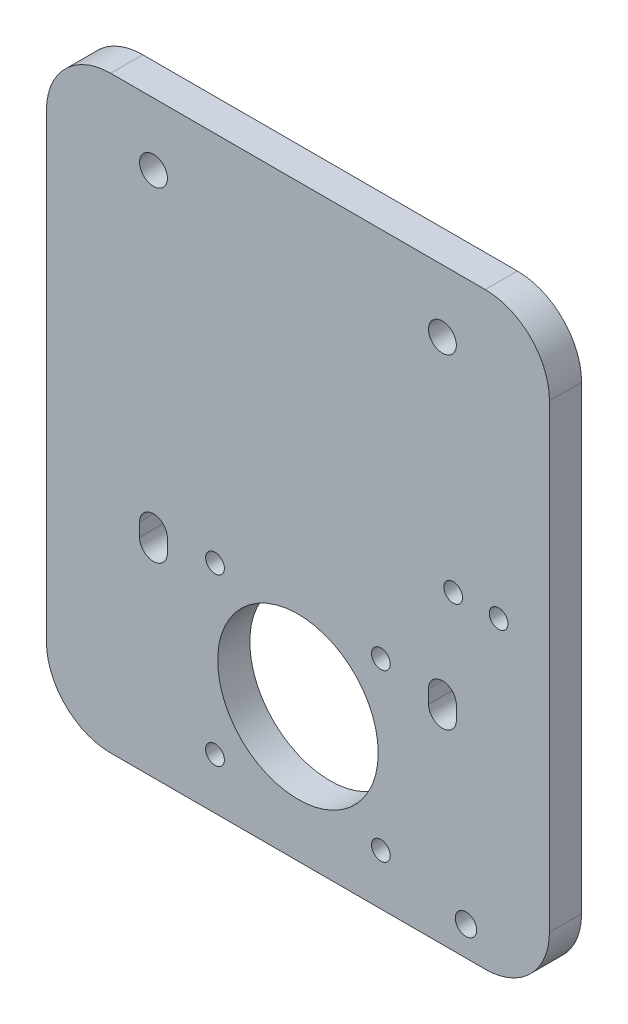
from build123d import *

# Parameters (mm, degrees)
MODEL_R               = 1.75
MODEL_R_2             = 15
MODEL_R_3             = 2.6
BASE_DEPTH            = 6
SKETCH1_R             = 1.75
CABLECHAINMOUNT_DEPTH = 10
SKETCH2_R             = 2
CABLETIEMOUNT_DEPTH   = 120.770614092


with BuildPart() as part:
    # Model → Base (new body)
    with BuildSketch(Plane.XY):
        with BuildLine():
            Line((47, 12), (47, 98))
            ThreePointArc((47, 98), (43.485281374, 106.485281374), (35, 110))
            Line((35, 110), (-35, 110))
            ThreePointArc((-35, 110), (-43.485281374, 106.485281374), (-47, 98))
            Line((-47, 98), (-47, 12))
            ThreePointArc((-47, 12), (-43.485281374, 3.514718626), (-35, 0))
            Line((-35, 0), (35, 0))
            ThreePointArc((35, 0), (43.485281374, 3.514718626), (47, 12))
        make_face()
        with Locations((-15.5, 9.5)):
            Circle(MODEL_R, mode=Mode.SUBTRACT)
        with BuildLine():
            Line((-29.6, 37.6), (-29.6, 40.1))
            ThreePointArc((-29.6, 40.1), (-27, 42.7), (-24.4, 40.1))
            Line((-24.4, 40.1), (-24.4, 37.6))
            ThreePointArc((-24.4, 37.6), (-27, 35), (-29.6, 37.6))
        make_face(mode=Mode.SUBTRACT)
        with Locations((-15.5, 40.5)):
            Circle(MODEL_R, mode=Mode.SUBTRACT)
        with Locations((15.5, 9.5)):
            Circle(MODEL_R, mode=Mode.SUBTRACT)
        with Locations((0, 25)):
            Circle(MODEL_R_2, mode=Mode.SUBTRACT)
        with Locations((15.5, 40.5)):
            Circle(MODEL_R, mode=Mode.SUBTRACT)
        with BuildLine():
            Line((29.6, 40.1), (29.6, 37.6))
            ThreePointArc((29.6, 37.6), (27, 35), (24.4, 37.6))
            Line((24.4, 37.6), (24.4, 40.1))
            ThreePointArc((24.4, 40.1), (27, 42.7), (29.6, 40.1))
        make_face(mode=Mode.SUBTRACT)
        with Locations((-27, 98.3)):
            Circle(MODEL_R_3, mode=Mode.SUBTRACT)
        with Locations((27, 98.3)):
            Circle(MODEL_R_3, mode=Mode.SUBTRACT)
    extrude(amount=BASE_DEPTH)

    # Sketch1 → CableChainMount (cut)
    with BuildSketch(Plane(origin=(0, 0, 0), x_dir=(-1, 0, 0), z_dir=(0, 0, -1))):
        with Locations((-29, 58)):
            Circle(SKETCH1_R)
        with Locations((-37.5, 58)):
            Circle(SKETCH1_R)
    extrude(amount=-CABLECHAINMOUNT_DEPTH, mode=Mode.SUBTRACT)

    # Sketch2 → CableTieMount (cut, through all)
    with BuildSketch(Plane.XY.offset(6)):
        with Locations((31.394827987, 5.505711601)):
            Circle(SKETCH2_R)
    extrude(amount=-CABLETIEMOUNT_DEPTH, mode=Mode.SUBTRACT)


solid = part.part
